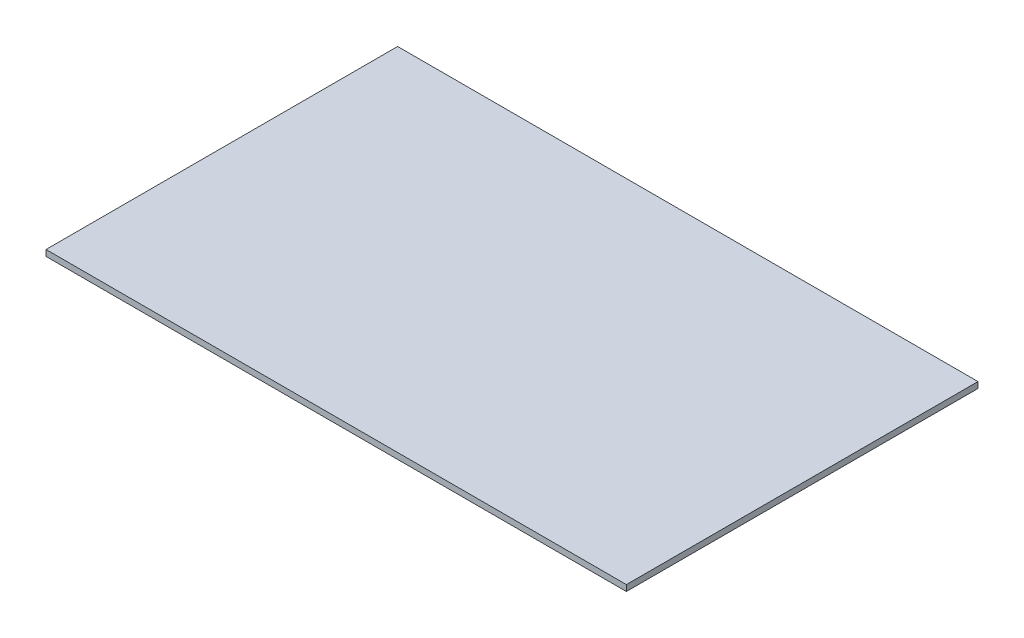
from build123d import *

# Parameters (mm, degrees)
SKETCH2_W           = 458
SKETCH2_H           = 4.7625
BOSS_EXTRUDE1_DEPTH = 277.48


with BuildPart() as part:
    # Sketch2 → Boss-Extrude1 (new body)
    with BuildSketch(Plane.XY):
        with Locations((229, 2.38125)):
            Rectangle(SKETCH2_W, SKETCH2_H)
    extrude(amount=BOSS_EXTRUDE1_DEPTH)


solid = part.part
